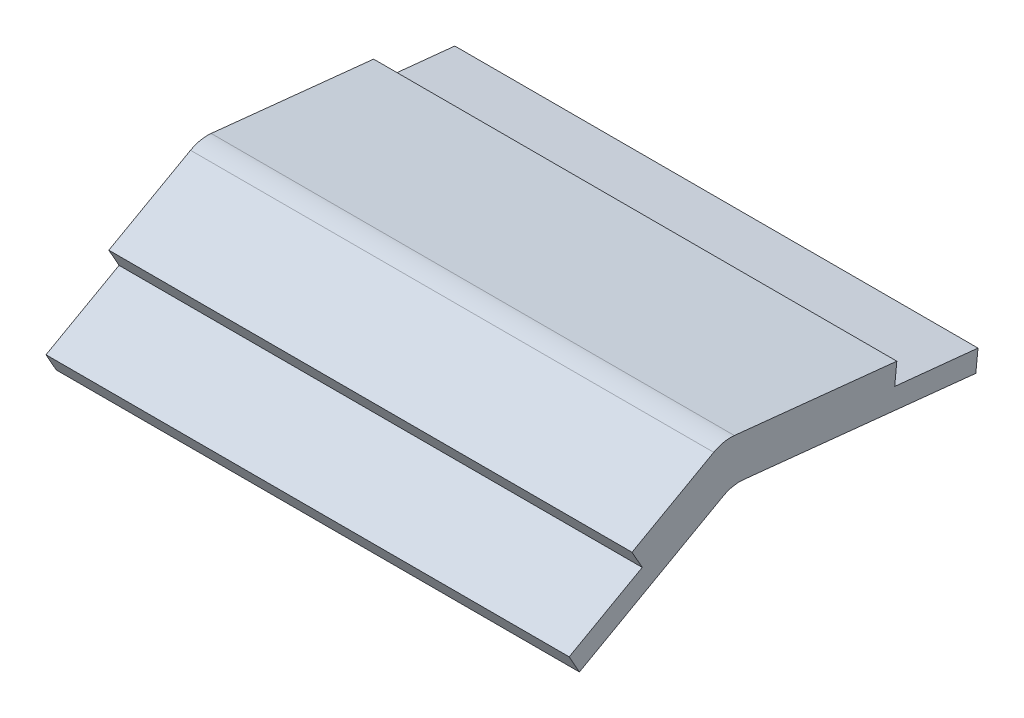
from build123d import *

# Parameters (mm, degrees)
BOSS_EXTRUDE1_DEPTH = 75
SKETCH3_W           = 3
SKETCH3_H           = 33.47977934
BOSS_EXTRUDE2_DEPTH = 8


with BuildPart() as part:
    # Sketch1 → Boss-Extrude1 (new body)
    with BuildSketch(Plane(origin=(0, 0, 0), x_dir=(0, 0, -1), z_dir=(1, 0, 0))):
        with BuildLine():
            Line((-17.045147988, 11.09483048), (-15.580534174, 8.476642867))
            Line((-15.580534174, 8.476642867), (-26.053284627, 2.618187613))
            Line((-26.053284627, 2.618187613), (-24.588670814, 0))
            Line((-24.588670814, 0), (-4.018503161, 11.506949134))
            ThreePointArc((-4.018503161, 11.506949134), (-2.587030391, 12.04032346), (-1.061322063, 12.116589836))
            Line((-1.061322063, 12.116589836), (32.239586361, 8.66041814))
            Line((32.239586361, 8.66041814), (32.549281207, 11.644390175))
            Line((32.549281207, 11.644390175), (20.610234377, 12.852347461))
            Line((20.610234377, 12.852347461), (20.912223699, 15.837109168))
            Line((20.912223699, 15.837109168), (-2.379077071, 18.254422638))
            ThreePointArc((-2.379077071, 18.254422638), (-3.904785399, 18.178156261), (-5.336258169, 17.644781935))
            Line((-5.336258169, 17.644781935), (-17.045147988, 11.09483048))
        make_face()
    extrude(amount=BOSS_EXTRUDE1_DEPTH)

    # Sketch3 → Boss-Extrude2 (add)
    with BuildSketch(Plane(origin=(0, 11.87848953, -1.232822204), x_dir=(1, 0, 0), z_dir=(0, -0.9946573448357569, 0.10323161513936713))):
        with Locations((1.5, -14.433422746)):
            Rectangle(SKETCH3_W, SKETCH3_H)
    extrude(amount=BOSS_EXTRUDE2_DEPTH)


solid = part.part
